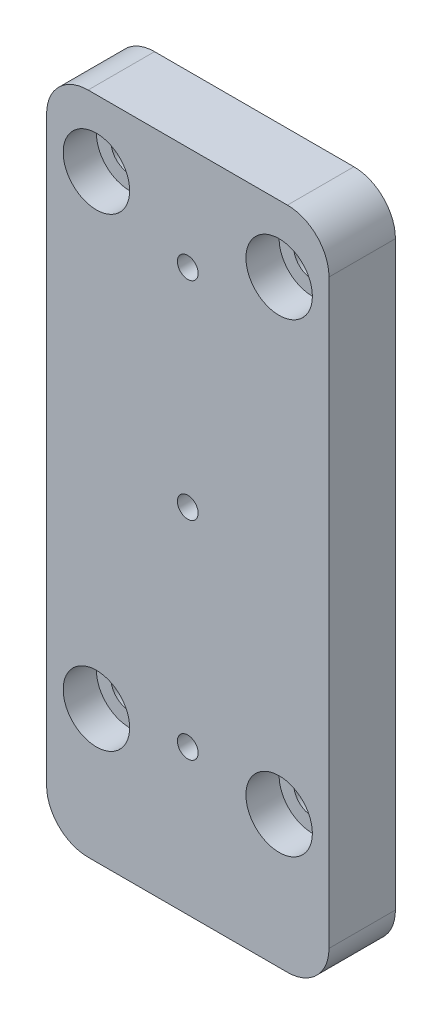
from build123d import *

# Parameters (mm, degrees)
ESQUISSE1_W                  = 34
ESQUISSE1_H                  = 80
BOSS_EXTRU_1_DEPTH           = 8
ENL_V_MAT_EXTRU_1_DEPTH      = 88.292611371
ENL_V_MAT_EXTRU_1_DEPTH_BACK = 88.292611371
ESQUISSE2_R                  = 1.25
ENL_V_MAT_EXTRU_2_DEPTH      = 88.292611371
ENL_V_MAT_EXTRU_2_DEPTH_BACK = 88.292611371
ESQUISSE3_R                  = 2.25
ESQUISSE4_R                  = 4
ENL_V_MAT_EXTRU_3_DEPTH      = 4
CONG_1_R                     = 5


with BuildPart() as part:
    # Esquisse1 → Boss.-Extru.1 (new body)
    with BuildSketch(Plane.XY):
        with Locations((17, 40)):
            Rectangle(ESQUISSE1_W, ESQUISSE1_H)
    extrude(amount=BOSS_EXTRU_1_DEPTH)

    # Esquisse2 → Enlèv. mat.-Extru.1 (cut, two sides: drawn at the far end of the back side and taken through both)
    with BuildSketch(Plane.XY.offset(8).offset(-ENL_V_MAT_EXTRU_1_DEPTH_BACK)):
        with Locations((17, 17.5)):
            Circle(ESQUISSE2_R)
        with Locations((17, 42.5)):
            Circle(ESQUISSE2_R)
        with Locations((17, 67.5)):
            Circle(ESQUISSE2_R)
        with Locations((17, 92.5)):
            Circle(ESQUISSE2_R)
        with Locations((17, 117.5)):
            Circle(ESQUISSE2_R)
        with Locations((17, 142.5)):
            Circle(ESQUISSE2_R)
        with Locations((17, 167.5)):
            Circle(ESQUISSE2_R)
        with Locations((17, 192.5)):
            Circle(ESQUISSE2_R)
    extrude(amount=ENL_V_MAT_EXTRU_1_DEPTH + ENL_V_MAT_EXTRU_1_DEPTH_BACK, mode=Mode.SUBTRACT)

    # Esquisse3 → Enlèv. mat.-Extru.2 (cut, two sides: drawn at the far end of the back side and taken through both)
    with BuildSketch(Plane.XY.offset(8).offset(-ENL_V_MAT_EXTRU_2_DEPTH_BACK)):
        with Locations((6, 16)):
            Circle(ESQUISSE3_R)
        with Locations((28, 16)):
            Circle(ESQUISSE3_R)
        with Locations((28, 72)):
            Circle(ESQUISSE3_R)
        with Locations((6, 72)):
            Circle(ESQUISSE3_R)
    extrude(amount=ENL_V_MAT_EXTRU_2_DEPTH + ENL_V_MAT_EXTRU_2_DEPTH_BACK, mode=Mode.SUBTRACT)

    # Esquisse4 → Enlèv. mat.-Extru.3 (cut)
    with BuildSketch(Plane.XY.offset(8)):
        with Locations((6, 16)):
            Circle(ESQUISSE4_R)
        with Locations((28, 16)):
            Circle(ESQUISSE4_R)
        with Locations((6, 72)):
            Circle(ESQUISSE4_R)
        with Locations((28, 72)):
            Circle(ESQUISSE4_R)
    extrude(amount=-ENL_V_MAT_EXTRU_3_DEPTH, mode=Mode.SUBTRACT)

    # Congé1
    cong_1_edges = [part.edges().sort_by_distance(p)[0] for p in [
        (0, 80, 4),
        (34, 80, 4),
        (34, 0, 4),
        (0, 0, 4),
    ]]
    fillet(cong_1_edges, radius=CONG_1_R)


solid = part.part
